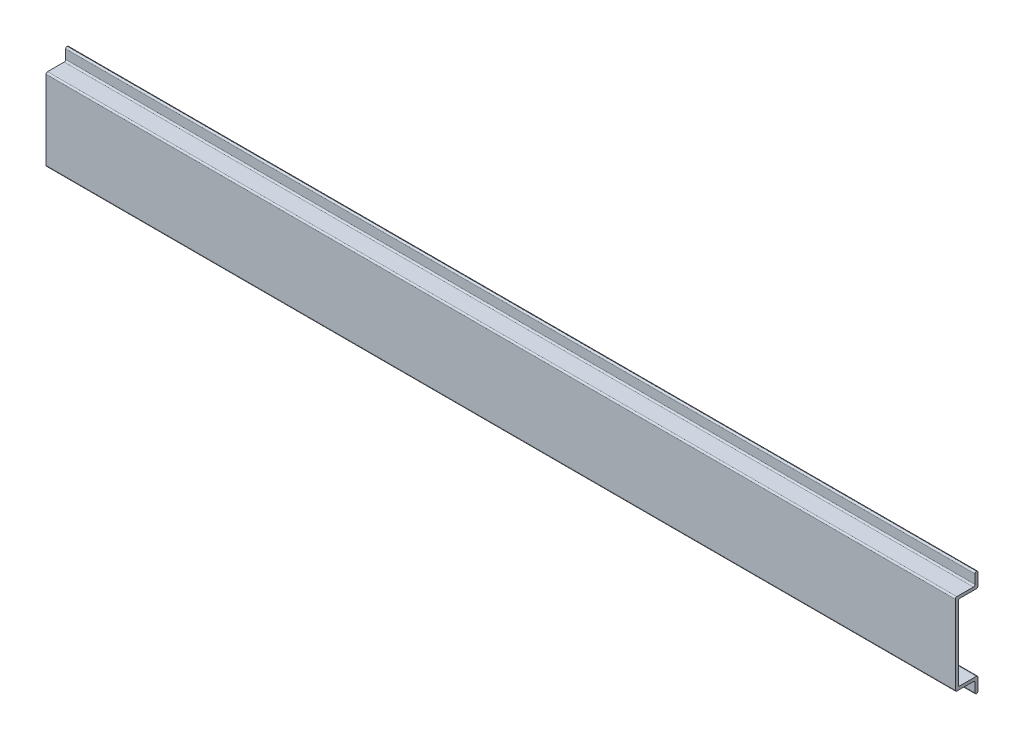
from build123d import *

# Parameters (mm, degrees)
SALIENTE_EXTRUIR1_DEPTH      = 150
SALIENTE_EXTRUIR1_DEPTH_BACK = 150
REDONDEO1_R                  = 0.5


with BuildPart() as part:
    # Croquis1 → Saliente-Extruir1 (new, two sides: drawn at the far end of the back side and taken through both)
    with BuildSketch(Plane(origin=(0, 0, 0), x_dir=(0, 0, -1), z_dir=(1, 0, 0)).offset(-SALIENTE_EXTRUIR1_DEPTH_BACK)):
        Polygon((0, 0), (0, 13.5), (6.5, 13.5), (6.5, 17.5), (7.5, 17.5), (7.5, 12.5), (1, 12.5), (1, -12.5), (7.5, -12.5), (7.5, -17.5), (6.5, -17.5), (6.5, -13.5), (0, -13.5), align=None)
    extrude(amount=SALIENTE_EXTRUIR1_DEPTH + SALIENTE_EXTRUIR1_DEPTH_BACK)

    # Redondeo1
    redondeo1_edges = [part.edges().sort_by_distance(p)[0] for p in [
        (0, 12.5, -1),
        (0, 12.5, -7.5),
        (0, 17.5, -7.5),
        (0, 17.5, -6.5),
        (0, 13.5, 0),
        (0, 13.5, -6.5),
        (0, -13.5, 0),
        (0, -13.5, -6.5),
        (0, -17.5, -6.5),
        (0, -17.5, -7.5),
        (0, -12.5, -7.5),
        (0, -12.5, -1),
    ]]
    fillet(redondeo1_edges, radius=REDONDEO1_R - 0.0001)  # a hair under: the kernel refuses the full size


solid = part.part
